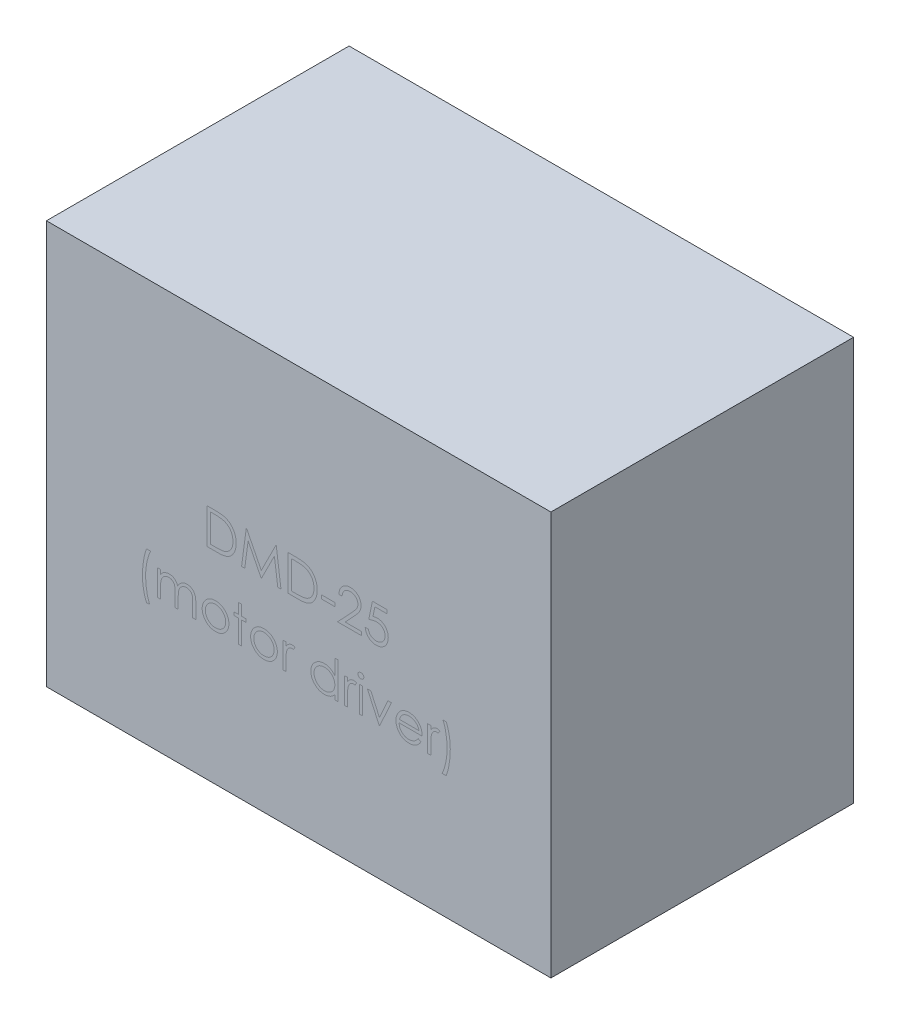
from build123d import *

# Parameters (mm, degrees)
SKETCH_1_W      = 50
SKETCH_1_H      = 40
EXTRUDE_1_DEPTH = 30


with BuildPart() as part:
    # 스케치1 → 보스-돌출1 (new body)
    with BuildSketch(Plane.XY):
        Rectangle(SKETCH_1_W, SKETCH_1_H)
    extrude(amount=EXTRUDE_1_DEPTH)


solid = part.part
